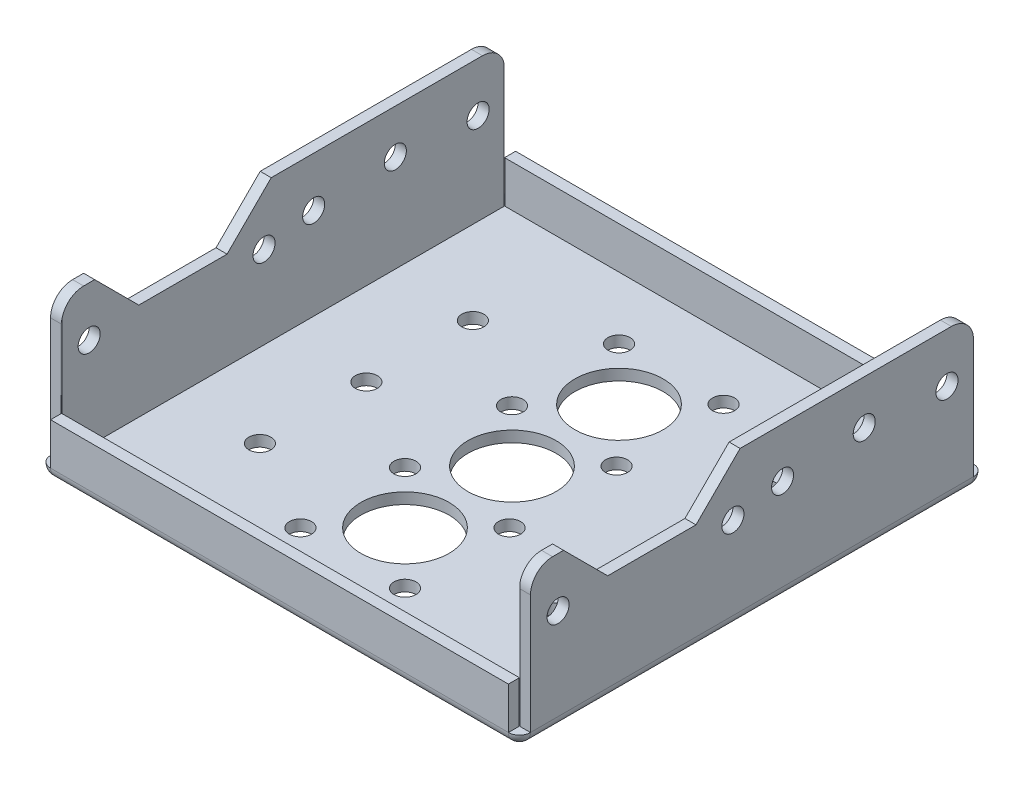
from build123d import *

# Parameters (mm, degrees)
SKETCH1_W           = 43.5
SKETCH1_H           = 42.15
SKETCH1_R           = 4
SKETCH1_R_2         = 1
BOSS_EXTRUDE1_DEPTH = 1
BOSS_EXTRUDE2_DEPTH = 3.8
BOSS_EXTRUDE5_DEPTH = 12.8
FILLET1_R           = 1
SKETCH3_R           = 1
CUT_EXTRUDE1_DEPTH  = 63.12336517


with BuildPart() as part:
    # Sketch1 → Boss-Extrude1 (new body)
    with BuildSketch(Plane(origin=(0, 0, 0), x_dir=(1, 0, 0), z_dir=(0, 1, 0))):
        with Locations((21.75, 21.075)):
            Rectangle(SKETCH1_W, SKETCH1_H)
        with Locations(Location((21.75, 21.075, 0), (0, 0, 270))):
            Circle(SKETCH1_R, mode=Mode.SUBTRACT)
        with Locations(Location((21.75, 30.775, 0), (0, 0, 270))):
            Circle(SKETCH1_R, mode=Mode.SUBTRACT)
        with Locations(Location((21.75, 11.375, 0), (0, 0, 90))):
            Circle(SKETCH1_R, mode=Mode.SUBTRACT)
        with Locations(Location((8.55, 21.075, 0), (0, 0, 270))):
            Circle(SKETCH1_R_2, mode=Mode.SUBTRACT)
        with Locations(Location((8.55, 30.725, 0), (0, 0, 270))):
            Circle(SKETCH1_R_2, mode=Mode.SUBTRACT)
        with Locations(Location((8.55, 11.425, 0), (0, 0, 90))):
            Circle(SKETCH1_R_2, mode=Mode.SUBTRACT)
        with Locations(Location((34.95, 11.425, 0), (0, 0, 270))):
            Circle(SKETCH1_R_2, mode=Mode.SUBTRACT)
        with Locations(Location((34.95, 21.075, 0), (0, 0, 90))):
            Circle(SKETCH1_R_2, mode=Mode.SUBTRACT)
        with Locations(Location((34.95, 30.725, 0), (0, 0, 90))):
            Circle(SKETCH1_R_2, mode=Mode.SUBTRACT)
        with Locations(Location((17.012384566, 35.512615434, 0), (0, 0, 270))):
            Circle(SKETCH1_R_2, mode=Mode.SUBTRACT)
        with Locations(Location((17.012384566, 25.812615434, 0), (0, 0, 270))):
            Circle(SKETCH1_R_2, mode=Mode.SUBTRACT)
        with Locations(Location((17.012384566, 16.112615434, 0), (0, 0, 270))):
            Circle(SKETCH1_R_2, mode=Mode.SUBTRACT)
        with Locations(Location((17.012384566, 6.637384566, 0), (0, 0, 270))):
            Circle(SKETCH1_R_2, mode=Mode.SUBTRACT)
        with Locations(Location((26.487615434, 6.637384566, 0), (0, 0, 90))):
            Circle(SKETCH1_R_2, mode=Mode.SUBTRACT)
        with Locations(Location((26.487615434, 16.112615434, 0), (0, 0, 90))):
            Circle(SKETCH1_R_2, mode=Mode.SUBTRACT)
        with Locations(Location((26.487615434, 25.812615434, 0), (0, 0, 90))):
            Circle(SKETCH1_R_2, mode=Mode.SUBTRACT)
        with Locations(Location((26.487615434, 35.512615434, 0), (0, 0, 90))):
            Circle(SKETCH1_R_2, mode=Mode.SUBTRACT)
    extrude(amount=BOSS_EXTRUDE1_DEPTH)

    # Sketch2 → Boss-Extrude2 (add)
    with BuildSketch(Plane(origin=(0, 1, 0), x_dir=(1, 0, 0), z_dir=(0, 1, 0))):
        with BuildLine():
            Line((1, 0.95), (1, 0))
            Line((1, 0), (42.5, 0))
            Line((42.5, 0), (42.5, 0.95))
            ThreePointArc((42.5, 0.95), (42.485355339, 0.985355339), (42.45, 1))
            Line((42.45, 1), (1.05, 1))
            ThreePointArc((1.05, 1), (1.014644661, 0.985355339), (1, 0.95))
        make_face()
        with BuildLine():
            Line((1.05, 41.15), (42.45, 41.15))
            ThreePointArc((42.45, 41.15), (42.485355339, 41.164644661), (42.5, 41.2))
            Line((42.5, 41.2), (42.5, 42.15))
            Line((42.5, 42.15), (1, 42.15))
            Line((1, 42.15), (1, 41.2))
            ThreePointArc((1, 41.2), (1.014644661, 41.164644661), (1.05, 41.15))
        make_face()
    extrude(amount=BOSS_EXTRUDE2_DEPTH)

    # Sketch2<6> → Boss-Extrude5 (add)
    with BuildSketch(Plane(origin=(0, 1, 0), x_dir=(1, 0, 0), z_dir=(0, 1, 0))):
        with BuildLine():
            Line((0.95, 41.15), (0, 41.15))
            Line((0, 41.15), (0, 1))
            Line((0, 1), (0.95, 1))
            ThreePointArc((0.95, 1), (0.985355339, 1.014644661), (1, 1.05))
            Line((1, 1.05), (1, 41.1))
            ThreePointArc((1, 41.1), (0.985355339, 41.135355339), (0.95, 41.15))
        make_face()
        with BuildLine():
            Line((43.5, 1), (43.5, 41.15))
            Line((43.5, 41.15), (42.55, 41.15))
            ThreePointArc((42.55, 41.15), (42.514644661, 41.135355339), (42.5, 41.1))
            Line((42.5, 41.1), (42.5, 1.05))
            ThreePointArc((42.5, 1.05), (42.514644661, 1.014644661), (42.55, 1))
            Line((42.55, 1), (43.5, 1))
        make_face()
    extrude(amount=BOSS_EXTRUDE5_DEPTH)

    # Fillet1
    # the kernel refuses this fillet: 1 mm, written as the material it takes off along each edge
    with BuildSketch(Plane(origin=(42.5, 1, -41.15), x_dir=(1, 0, 0), z_dir=(0, 0, -1))) as fillet1_piece_1_section:
        Polygon((0, 0), (FILLET1_R * 1.02, 0), (FILLET1_R * 1.02, FILLET1_R * 1.02), (0, FILLET1_R * 1.02), align=None)
    fillet1_piece_1 = extrude(amount=FILLET1_R * 1.02, mode=Mode.PRIVATE)
    fillet1_piece_1 = fillet1_piece_1 - Plane(origin=(42.5, 1, -41.15), x_dir=(-0.7071067811865475, 0.7071067811865475, 0), z_dir=(0, 0, -1)) * Sphere(FILLET1_R, mode=Mode.PRIVATE)
    add(fillet1_piece_1, mode=Mode.SUBTRACT)
    with BuildSketch(Plane(origin=(42.5, 1, -1), x_dir=(1, 0, 0), z_dir=(0, 0, 1))) as fillet1_piece_2_section:
        Polygon((0, 0), (FILLET1_R * 1.02, 0), (FILLET1_R * 1.02, -FILLET1_R * 1.02), (0, -FILLET1_R * 1.02), align=None)
    fillet1_piece_2 = extrude(amount=FILLET1_R * 1.02, mode=Mode.PRIVATE)
    fillet1_piece_2 = fillet1_piece_2 - Plane(origin=(42.5, 1, -1), x_dir=(-0.7071067811865475, 0.7071067811865475, 0), z_dir=(0, 0, 1)) * Sphere(FILLET1_R, mode=Mode.PRIVATE)
    add(fillet1_piece_2, mode=Mode.SUBTRACT)
    with BuildSketch(Plane(origin=(1, 1, -1), x_dir=(-1, 0, 0), z_dir=(0, 0, 1))) as fillet1_piece_3_section:
        Polygon((0, 0), (FILLET1_R * 1.02, 0), (FILLET1_R * 1.02, FILLET1_R * 1.02), (0, FILLET1_R * 1.02), align=None)
    fillet1_piece_3 = extrude(amount=FILLET1_R * 1.02, mode=Mode.PRIVATE)
    fillet1_piece_3 = fillet1_piece_3 - Plane(origin=(1, 1, -1), x_dir=(0.7071067811865475, 0.7071067811865475, 0), z_dir=(0, 0, 1)) * Sphere(FILLET1_R, mode=Mode.PRIVATE)
    add(fillet1_piece_3, mode=Mode.SUBTRACT)
    with BuildSketch(Plane(origin=(42.5, 0, -42.15), x_dir=(0, 0, 1), z_dir=(-1, 0, 0))) as fillet1_piece_4:
        with BuildLine():
            CenterArc((FILLET1_R, FILLET1_R), FILLET1_R, 180, 90)
            Line((0, FILLET1_R), (0, 0))
            Line((0, 0), (FILLET1_R, 0))
        make_face()
    extrude(amount=45, mode=Mode.SUBTRACT)
    with BuildSketch(Plane(origin=(43.5, 0, -1), x_dir=(0, 1, 0), z_dir=(0, 0, -1))) as fillet1_piece_5:
        with BuildLine():
            CenterArc((FILLET1_R, -FILLET1_R), FILLET1_R, 90, 90)
            Line((0, -FILLET1_R), (0, 0))
            Line((0, 0), (FILLET1_R, 0))
        make_face()
    extrude(amount=40.15, mode=Mode.SUBTRACT)
    with BuildSketch(Plane(origin=(1, 0, 0), x_dir=(0, 1, 0), z_dir=(1, 0, 0))) as fillet1_piece_6:
        with BuildLine():
            CenterArc((FILLET1_R, -FILLET1_R), FILLET1_R, 90, 90)
            Line((0, -FILLET1_R), (0, 0))
            Line((0, 0), (FILLET1_R, 0))
        make_face()
    extrude(amount=41.5, mode=Mode.SUBTRACT)
    with BuildSketch(Plane(origin=(0, 0, -44.65), x_dir=(0, 1, 0), z_dir=(0, 0, 1))) as fillet1_piece_7:
        with BuildLine():
            CenterArc((FILLET1_R, -FILLET1_R), FILLET1_R, 90, 90)
            Line((0, -FILLET1_R), (0, 0))
            Line((0, 0), (FILLET1_R, 0))
        make_face()
    extrude(amount=43.65, mode=Mode.SUBTRACT)

    # Sketch3 → Cut-Extrude1 (cut, through all)
    with BuildSketch(Plane.ZY):
        with BuildLine():
            ThreePointArc((-3, 13.8), (-1.585786438, 13.214213562), (-1, 11.8))
            Line((-1, 11.8), (-1, 13.8))
            Line((-1, 13.8), (-3, 13.8))
        make_face()
        Polygon((-4, 13.8), (-20, 13.8), (-16, 9.8), (-8, 9.8), align=None)
        with Locations((-19.35, 8.5)):
            Circle(SKETCH3_R)
        with Locations((-23.85, 9.3)):
            Circle(SKETCH3_R)
        with Locations((-31.25, 9.8)):
            Circle(SKETCH3_R)
        with Locations((-38.75, 9.3)):
            Circle(SKETCH3_R)
        with BuildLine():
            Line((-39.15, 13.8), (-41.15, 13.8))
            Line((-41.15, 13.8), (-41.15, 11.8))
            ThreePointArc((-41.15, 11.8), (-40.564213562, 13.214213562), (-39.15, 13.8))
        make_face()
        with Locations((-3.5, 9.3)):
            Circle(SKETCH3_R)
    extrude(amount=-CUT_EXTRUDE1_DEPTH, mode=Mode.SUBTRACT)


solid = part.part
